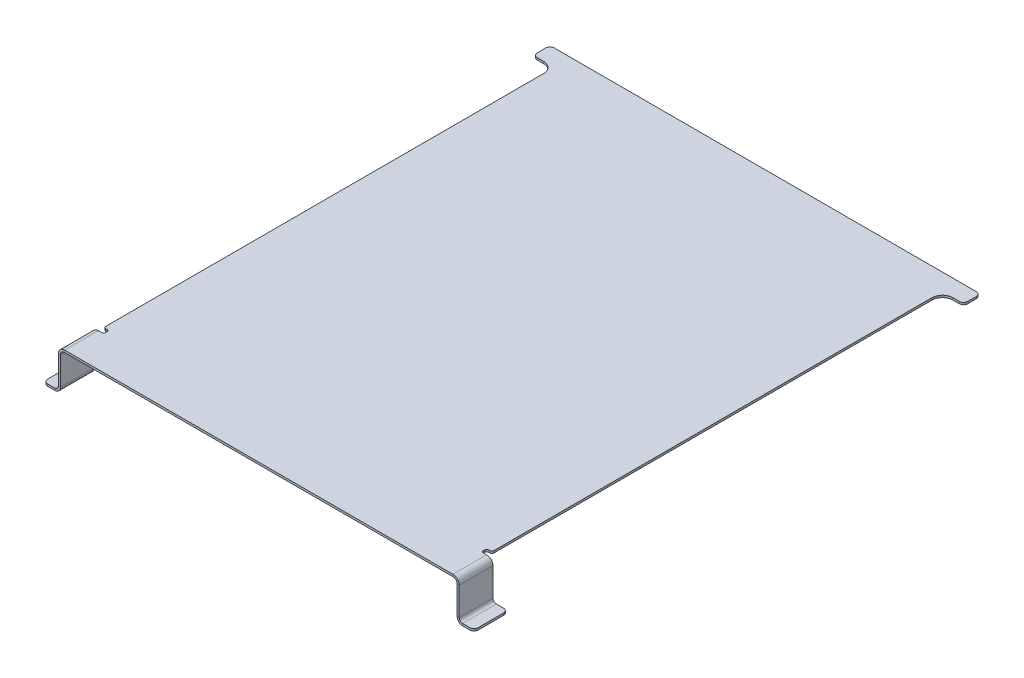
from build123d import *

# Parameters (mm, degrees)
SKETCH5_W                      = 301.625
SKETCH5_H                      = 1.5875
BASE_FLANGE1_DEPTH             = 381
SKETCH10_W                     = 11.1125
SKETCH10_H                     = 12.7
BOSS_EXTRUDE1_DEPTH            = 1.5875
EDGE_FLANGE1_STRIP_W           = 12.7
EDGE_FLANGE1_STRIP_H           = 1.5875
EDGE_FLANGE1_STRIP_CUT_DEPTH   = 368.3
EDGE_FLANGE1_STRIP_2_W         = 12.7
EDGE_FLANGE1_STRIP_2_H         = 1.5875
EDGE_FLANGE1_STRIP_CUT_2_DEPTH = 368.3
EDGE_FLANGE1_DEPTH             = 368.3
EDGE_FLANGE1_BEND_DEPTH        = 368.3
CUT_EXTRUDE1_START             = -25.4
CUT_EXTRUDE1_DEPTH             = 342.9
EDGE_FLANGE2_STRIP_W           = 11.43
EDGE_FLANGE2_STRIP_H           = 1.5875
EDGE_FLANGE2_STRIP_CUT_DEPTH   = 25.4
EDGE_FLANGE2_DEPTH             = 25.4
EDGE_FLANGE3_STRIP_W           = 11.43
EDGE_FLANGE3_STRIP_H           = 1.5875
EDGE_FLANGE3_STRIP_CUT_DEPTH   = 25.4
EDGE_FLANGE3_DEPTH             = 25.4
FILLET1_R                      = 8
FILLET2_R                      = 3.175
SKETCH30_W                     = 4
SKETCH30_H                     = 1.5875
CUT_EXTRUDE9_DEPTH             = 4
SKETCH31_W                     = 4
SKETCH31_H                     = 1.5875
CUT_EXTRUDE10_DEPTH            = 4
FILLET4_R                      = 1.5


# Sheet-metal steps are written as plain solids
with BuildPart() as part:
    # Sketch5 → Base-Flange1 (new body)
    with BuildSketch(Plane.XY):
        with Locations((0, -0.79375)):
            Rectangle(SKETCH5_W, SKETCH5_H)
    extrude(amount=BASE_FLANGE1_DEPTH)

    # Sketch10 → Boss-Extrude1 (add)
    with BuildSketch(Plane(origin=(0, 0, 0), x_dir=(1, 0, 0), z_dir=(0, 1, 0))):
        with Locations((-156.36875, -6.35)):
            Rectangle(SKETCH10_W, SKETCH10_H)
        with Locations((156.36875, -6.35)):
            Rectangle(SKETCH10_W, SKETCH10_H)
    extrude(amount=-BOSS_EXTRUDE1_DEPTH)

    # Edge-Flange1 strip (across the edge) → Edge-Flange1 strip cut (cut)
    with BuildSketch(Plane(origin=(150.8125, -1.5875, 12.7), x_dir=(-1, 0, 0), z_dir=(0, 0, 1))):
        with Locations((-1.5875, -0.79375)):
            Rectangle(EDGE_FLANGE1_STRIP_W, EDGE_FLANGE1_STRIP_H)
    extrude(amount=EDGE_FLANGE1_STRIP_CUT_DEPTH, mode=Mode.SUBTRACT)

    # Edge-Flange1 strip 2 (across the edge) → Edge-Flange1 strip cut 2 (cut)
    with BuildSketch(Plane(origin=(-150.8125, -1.5875, 381), x_dir=(1, 0, 0), z_dir=(0, 0, -1))):
        with Locations((-1.5875, -0.79375)):
            Rectangle(EDGE_FLANGE1_STRIP_2_W, EDGE_FLANGE1_STRIP_2_H)
    extrude(amount=EDGE_FLANGE1_STRIP_CUT_2_DEPTH, mode=Mode.SUBTRACT)

    # Edge-Flange1 section (across the edge) → Edge-Flange1 (add)
    with BuildSketch(Plane(origin=(150.8125, -1.5875, 12.7), x_dir=(-1, 0, 0), z_dir=(0, 0, 1))):
        with BuildLine():
            Line((0, 3.175), (0, 28.4125))
            Line((0, 28.4125), (1.5875, 28.4125))
            Line((1.5875, 28.4125), (1.5875, 3.175))
            ThreePointArc((1.5875, 3.175), (2.51743597, 0.92993597), (4.7625, 0))
            Line((4.7625, 0), (4.7625, -1.5875))
            ThreePointArc((4.7625, -1.5875), (1.394903955, -0.192596045), (0, 3.175))
        make_face()
    extrude(amount=EDGE_FLANGE1_DEPTH)

    # Edge-Flange1 section 2 (across the edge) → Edge-Flange1 bend (add)
    with BuildSketch(Plane(origin=(-150.8125, -1.5875, 381), x_dir=(1, 0, 0), z_dir=(0, 0, -1))):
        with BuildLine():
            Line((0, 3.175), (0, 28.4125))
            Line((0, 28.4125), (1.5875, 28.4125))
            Line((1.5875, 28.4125), (1.5875, 3.175))
            ThreePointArc((1.5875, 3.175), (2.51743597, 0.92993597), (4.7625, 0))
            Line((4.7625, 0), (4.7625, -1.5875))
            ThreePointArc((4.7625, -1.5875), (1.394903955, -0.192596045), (0, 3.175))
        make_face()
    extrude(amount=EDGE_FLANGE1_BEND_DEPTH)

    # Sketch20 → Cut-Extrude1 (cut)
    with BuildSketch(Plane.XY.offset(381).offset(CUT_EXTRUDE1_START)):
        with BuildLine():
            Line((-150.8125, -4.7625), (-150.8125, -30))
            Line((-150.8125, -30), (-149.225, -30))
            Line((-149.225, -30), (-149.225, -4.7625))
            ThreePointArc((-149.225, -4.7625), (-148.29506403, -2.51743597), (-146.05, -1.5875))
            Line((-146.05, -1.5875), (-146.05, 0))
            ThreePointArc((-146.05, 0), (-149.417596045, -1.394903955), (-150.8125, -4.7625))
        make_face()
        with BuildLine():
            Line((149.225, -4.7625), (149.225, -30))
            Line((149.225, -30), (150.8125, -30))
            Line((150.8125, -30), (150.8125, -4.7625))
            ThreePointArc((150.8125, -4.7625), (149.417596045, -1.394903955), (146.05, 0))
            Line((146.05, 0), (146.05, -1.5875))
            ThreePointArc((146.05, -1.5875), (148.29506403, -2.51743597), (149.225, -4.7625))
        make_face()
    extrude(amount=-CUT_EXTRUDE1_DEPTH, mode=Mode.SUBTRACT)

    # Edge-Flange2 strip (across the edge) → Edge-Flange2 strip cut (cut)
    with BuildSketch(Plane(origin=(-150.8125, -30, 355.6), x_dir=(0, 1, 0), z_dir=(0, 0, 1))):
        with Locations((-1.5875, -0.79375)):
            Rectangle(EDGE_FLANGE2_STRIP_W, EDGE_FLANGE2_STRIP_H)
    extrude(amount=EDGE_FLANGE2_STRIP_CUT_DEPTH, mode=Mode.SUBTRACT)

    # Edge-Flange2 section (across the edge) → Edge-Flange2 (add)
    with BuildSketch(Plane(origin=(-150.8125, -30, 355.6), x_dir=(0, 1, 0), z_dir=(0, 0, 1))):
        with BuildLine():
            Line((0, 2.54), (0, 11.1125))
            Line((0, 11.1125), (1.5875, 11.1125))
            Line((1.5875, 11.1125), (1.5875, 2.54))
            ThreePointArc((1.5875, 2.54), (2.331448776, 0.743948776), (4.1275, 0))
            Line((4.1275, 0), (4.1275, -1.5875))
            ThreePointArc((4.1275, -1.5875), (1.208916761, -0.378583239), (0, 2.54))
        make_face()
    extrude(amount=EDGE_FLANGE2_DEPTH)

    # Edge-Flange3 strip (across the edge) → Edge-Flange3 strip cut (cut)
    with BuildSketch(Plane(origin=(150.8125, -30, 381), x_dir=(0, 1, 0), z_dir=(0, 0, -1))):
        with Locations((-1.5875, -0.79375)):
            Rectangle(EDGE_FLANGE3_STRIP_W, EDGE_FLANGE3_STRIP_H)
    extrude(amount=EDGE_FLANGE3_STRIP_CUT_DEPTH, mode=Mode.SUBTRACT)

    # Edge-Flange3 section (across the edge) → Edge-Flange3 (add)
    with BuildSketch(Plane(origin=(150.8125, -30, 381), x_dir=(0, 1, 0), z_dir=(0, 0, -1))):
        with BuildLine():
            Line((0, 2.54), (0, 11.1125))
            Line((0, 11.1125), (1.5875, 11.1125))
            Line((1.5875, 11.1125), (1.5875, 2.54))
            ThreePointArc((1.5875, 2.54), (2.331448776, 0.743948776), (4.1275, 0))
            Line((4.1275, 0), (4.1275, -1.5875))
            ThreePointArc((4.1275, -1.5875), (1.208916761, -0.378583239), (0, 2.54))
        make_face()
    extrude(amount=EDGE_FLANGE3_DEPTH)

    # Fillet1
    fillet1_edges = [part.edges().sort_by_distance(p)[0] for p in [
        (-146.05, -0.79375, 12.7),
        (146.05, -0.79375, 12.7),
    ]]
    fillet(fillet1_edges, radius=FILLET1_R)

    # Fillet2
    fillet2_edges = [part.edges().sort_by_distance(p)[0] for p in [
        (-161.925, -0.79375, 12.7),
        (-161.925, -0.79375, 0),
        (-161.925, -29.20625, 355.6),
        (-161.925, -29.20625, 381),
        (161.925, -29.20625, 381),
        (161.925, -29.20625, 355.6),
        (161.925, -0.79375, 0),
        (161.925, -0.79375, 12.7),
    ]]
    fillet(fillet2_edges, radius=FILLET2_R)

    # Sketch30 → Cut-Extrude9 (cut)
    with BuildSketch(Plane.ZY.offset(146.05)):
        with Locations((353.6, -0.79375)):
            Rectangle(SKETCH30_W, SKETCH30_H)
    extrude(amount=-CUT_EXTRUDE9_DEPTH, mode=Mode.SUBTRACT)

    # Sketch31 → Cut-Extrude10 (cut)
    with BuildSketch(Plane(origin=(146.05, 0, 0), x_dir=(0, 0, -1), z_dir=(1, 0, 0))):
        with Locations((-353.6, -0.79375)):
            Rectangle(SKETCH31_W, SKETCH31_H)
    extrude(amount=-CUT_EXTRUDE10_DEPTH, mode=Mode.SUBTRACT)

    # Fillet4
    fillet4_edges = [part.edges().sort_by_distance(p)[0] for p in [
        (-146.05, -0.79375, 351.6),
        (-142.05, -0.79375, 351.6),
        (-142.05, -0.79375, 355.6),
        (146.05, -0.79375, 351.6),
        (142.05, -0.79375, 351.6),
        (142.05, -0.79375, 355.6),
    ]]
    fillet(fillet4_edges, radius=FILLET4_R)


solid = part.part
